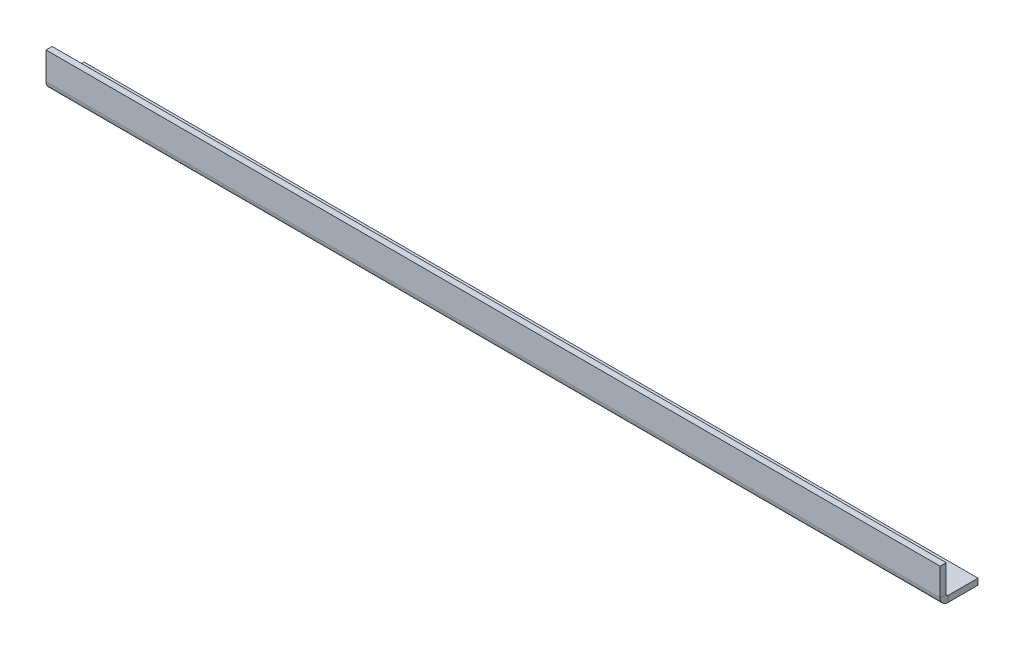
from build123d import *

# Parameters (mm, degrees)
SKETCH1_W          = 464.185
SKETCH1_H          = 15.24
BASE_FLANGE1_DEPTH = 3.175
EDGE_FLANGE1_DEPTH = 464.185


# Sheet-metal steps are written as plain solids
with BuildPart() as part:
    # Sketch1 → Base-Flange1 (new body)
    with BuildSketch(Plane(origin=(0, 0, 0), x_dir=(1, 0, 0), z_dir=(0, 1, 0))):
        Rectangle(SKETCH1_W, SKETCH1_H)
    extrude(amount=-BASE_FLANGE1_DEPTH)

    # Edge-Flange1 section (across the edge) → Edge-Flange1 (add)
    with BuildSketch(Plane(origin=(-232.0925, 0, 8.89), x_dir=(0, 0, -1), z_dir=(1, 0, 0))):
        with BuildLine():
            Line((-3.175, 1), (-3.175, 15.24))
            Line((-3.175, 15.24), (0, 15.24))
            Line((0, 15.24), (0, 1))
            ThreePointArc((0, 1), (0.292893219, 0.292893219), (1, 0))
            Line((1, 0), (1.27, 0))
            Line((1.27, 0), (1.27, -3.175))
            Line((1.27, -3.175), (1, -3.175))
            ThreePointArc((1, -3.175), (-1.952170811, -1.952170811), (-3.175, 1))
        make_face()
    extrude(amount=EDGE_FLANGE1_DEPTH)


solid = part.part
